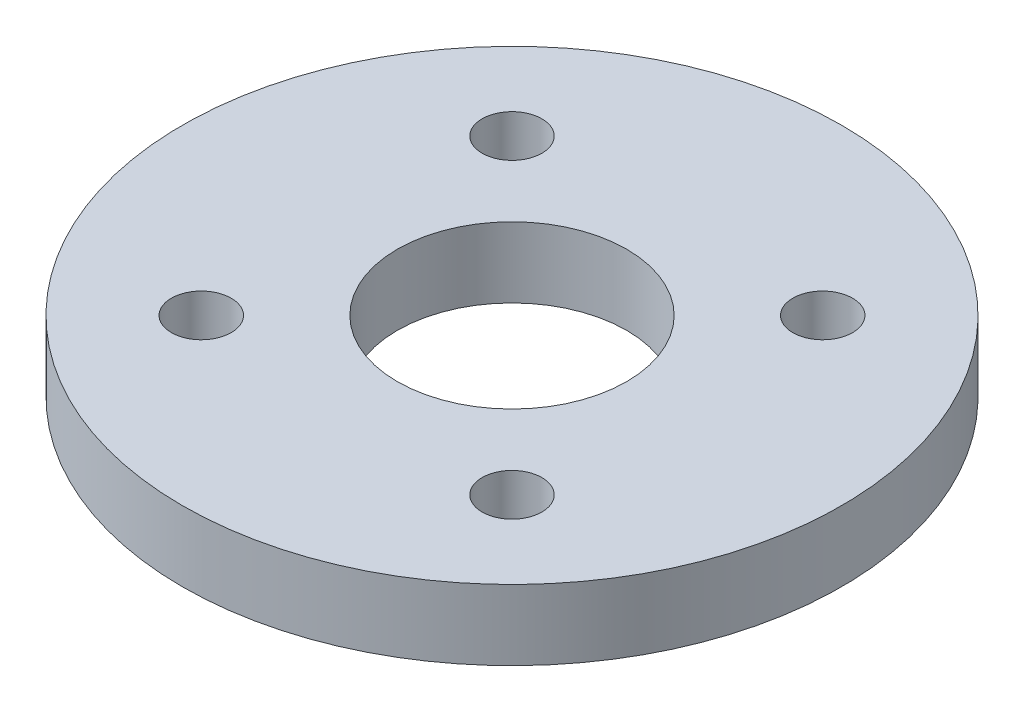
from build123d import *

# Parameters (mm, degrees)
SKETCH1_R           = 18.75
SKETCH1_R_2         = 1.7
SKETCH1_R_3         = 6.525
BOSS_EXTRUDE1_DEPTH = 4


with BuildPart() as part:
    # Sketch1 → Boss-Extrude1 (new body)
    with BuildSketch(Plane(origin=(0, 0, 0), x_dir=(1, 0, 0), z_dir=(0, 1, 0))):
        Circle(SKETCH1_R)
        with Locations((-8.838834765, -8.838834765)):
            Circle(SKETCH1_R_2, mode=Mode.SUBTRACT)
        with Locations((8.838834765, -8.838834765)):
            Circle(SKETCH1_R_2, mode=Mode.SUBTRACT)
        with Locations((-8.838834765, 8.838834765)):
            Circle(SKETCH1_R_2, mode=Mode.SUBTRACT)
        Circle(SKETCH1_R_3, mode=Mode.SUBTRACT)
        with Locations((8.838834765, 8.838834765)):
            Circle(SKETCH1_R_2, mode=Mode.SUBTRACT)
    extrude(amount=BOSS_EXTRUDE1_DEPTH)


solid = part.part
